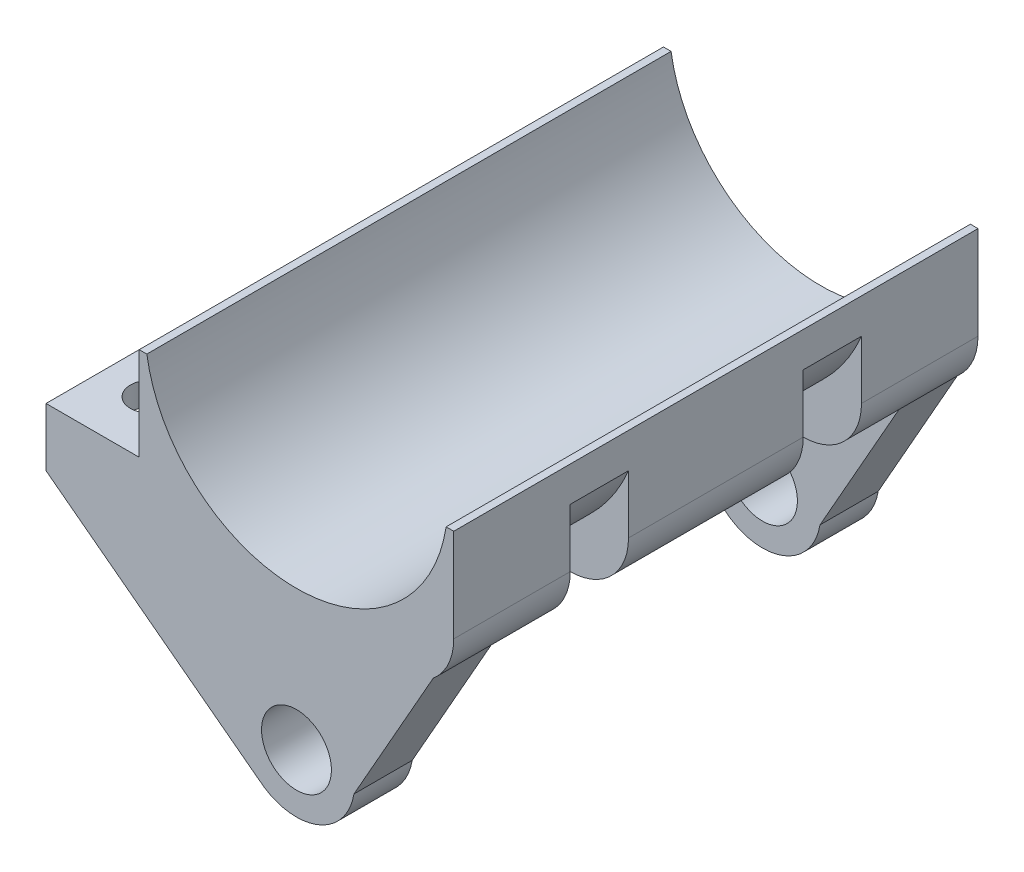
from build123d import *

# Parameters (mm, degrees)
BOSS_EXTRUDE1_DEPTH = 45
SKETCH2_W           = 10
SKETCH2_H           = 5
BOSS_EXTRUDE2_DEPTH = 15
SKETCH3_R           = 3
CUT_EXTRUDE1_DEPTH  = 50.317846668
FILLET1_R           = 5
CUT_EXTRUDE2_DEPTH  = 5
LPATTERN1_COUNT     = 2
LPATTERN1_PITCH     = 20
CHAMFER1_DEPTH      = 5
CHAMFER1_START      = 40
CHAMFER1_2_DEPTH    = 5
BOSS_EXTRUDE3_DEPTH = 2
BOSS_EXTRUDE9_REACH = 52.361
SKETCH8_W           = 8.2
SKETCH8_H           = 2
SKETCH9_R           = 1.75
CUT_EXTRUDE4_DEPTH  = 47


with BuildPart() as part:
    # Sketch1 → Boss-Extrude1 (new body)
    with BuildSketch(Plane.XY):
        with BuildLine():
            Line((12.845232579, 13), (13.5, 13))
            Line((13.5, 13), (13.5, 5))
            ThreePointArc((13.5, 5), (12.035533906, 1.464466094), (8.5, 0))
            Line((8.5, 0), (-8.5, 0))
            ThreePointArc((-8.5, 0), (-12.035533906, 1.464466094), (-13.5, 5))
            Line((-13.5, 5), (-13.5, 13))
            Line((-13.5, 13), (-12.845232579, 13))
            ThreePointArc((-12.845232579, 13), (0, 2), (12.845232579, 13))
        make_face()
    extrude(amount=BOSS_EXTRUDE1_DEPTH)

    # Sketch2 → Boss-Extrude2 (add)
    with BuildSketch(Plane.XZ):
        with Locations((0, 42.5)):
            Rectangle(SKETCH2_W, SKETCH2_H)
        with Locations((0, 2.5)):
            Rectangle(SKETCH2_W, SKETCH2_H)
    extrude(amount=BOSS_EXTRUDE2_DEPTH)

    # Sketch3 → Cut-Extrude1 (cut, through all)
    with BuildSketch(Plane.XY.offset(45)):
        with Locations((0, -10)):
            Circle(SKETCH3_R)
    extrude(amount=-CUT_EXTRUDE1_DEPTH, mode=Mode.SUBTRACT)

    # Fillet1
    fillet1_edges = [part.edges().sort_by_distance(p)[0] for p in [
        (-5, -15, 2.5),
        (-5, -15, 42.5),
        (5, -15, 42.5),
        (5, -15, 2.5),
    ]]
    fillet(fillet1_edges, radius=FILLET1_R - 0.0001)  # a hair under: the kernel refuses the full size

    # Sketch4 → Cut-Extrude2 (cut)
    with BuildSketch(Plane.XY.offset(10)):
        with BuildLine():
            Line((-13.5, 10), (-13.5, 5))
            ThreePointArc((-13.5, 5), (-12.035533906, 1.464466094), (-8.5, 0))
            Line((-8.5, 0), (5, 0))
            Line((5, 0), (8.5, 0))
            ThreePointArc((8.5, 0), (12.035533906, 1.464466094), (13.5, 5))
            Line((13.5, 5), (13.5, 10))
            ThreePointArc((13.5, 10), (8.11249037, 3.456264445), (0, 1))
            ThreePointArc((0, 1), (-8.11249037, 3.456264445), (-13.5, 10))
        make_face()
    cut_extrude2 = extrude(amount=CUT_EXTRUDE2_DEPTH, mode=Mode.SUBTRACT)

    # LPattern1: Cut-Extrude2 ×2
    with Locations(*[(0, 0, i * LPATTERN1_PITCH) for i in range(1, LPATTERN1_COUNT)]):
        add(cut_extrude2, mode=Mode.SUBTRACT)

    # Chamfer1: read off the stored shape, not the designer's step
    # Chamfer1 outline → Chamfer1 (add)
    with BuildSketch(Plane.XY):
        with BuildLine():
            ThreePointArc((5, -10), (4.983300978, -10.408303031), (4.933315454, -10.813878757))
            Line((4.933315454, -10.813878757), (11.733315454, 1.186121243))
            ThreePointArc((11.733315454, 1.186121243), (10.222005548, 0.305886996), (8.5, 0))
            Line((8.5, 0), (5, 0))
            Line((5, 0), (5, -10))
        make_face()
        with BuildLine():
            Line((-11.733315454, 1.186121243), (-4.933315454, -10.813878757))
            ThreePointArc((-4.933315454, -10.813878757), (-4.983300978, -10.408303031), (-5, -10))
            Line((-5, -10), (-5, 0))
            Line((-5, 0), (-8.5, 0))
            ThreePointArc((-8.5, 0), (-10.222005548, 0.305886996), (-11.733315454, 1.186121243))
        make_face()
    extrude(amount=CHAMFER1_DEPTH)

    # Chamfer1 2 outline → Chamfer1 2 (add)
    with BuildSketch(Plane.XY.offset(CHAMFER1_START)):
        with BuildLine():
            ThreePointArc((5, -10), (4.983300978, -10.408303031), (4.933315454, -10.813878757))
            Line((4.933315454, -10.813878757), (11.733315454, 1.186121243))
            ThreePointArc((11.733315454, 1.186121243), (10.222005548, 0.305886996), (8.5, 0))
            Line((8.5, 0), (5, 0))
            Line((5, 0), (5, -10))
        make_face()
        with BuildLine():
            Line((-11.733315454, 1.186121243), (-4.933315454, -10.813878757))
            ThreePointArc((-4.933315454, -10.813878757), (-4.983300978, -10.408303031), (-5, -10))
            Line((-5, -10), (-5, 0))
            Line((-5, 0), (-8.5, 0))
            ThreePointArc((-8.5, 0), (-10.222005548, 0.305886996), (-11.733315454, 1.186121243))
        make_face()
    extrude(amount=CHAMFER1_2_DEPTH)

    # Sketch6 → Boss-Extrude3 (add)
    with BuildSketch(Plane(origin=(0, 0, 0), x_dir=(-1, 0, 0), z_dir=(0, 0, -1))):
        Polygon((3.223775495, -13.830713979), (21.5, 0), (21.5, 5), (13.5, 5), align=None)
    boss_extrude3 = extrude(amount=-BOSS_EXTRUDE3_DEPTH)

    # Mirror1: Boss-Extrude3 across plane
    add(boss_extrude3.mirror(Plane.XY.offset(22.5)))

    # Sketch8 → Boss-Extrude9 (add, up to next)
    with BuildSketch(Plane.XY.offset(2), mode=Mode.PRIVATE) as boss_extrude9_sk1:
        with Locations((-17.4, 4)):
            Rectangle(SKETCH8_W, SKETCH8_H)
    boss_extrude9_tool1 = extrude(boss_extrude9_sk1.sketch, amount=BOSS_EXTRUDE9_REACH, mode=Mode.PRIVATE) - part.part
    add(boss_extrude9_tool1.solids().sort_by_distance((-17.4, 4, 2))[0])

    # Sketch9 → Cut-Extrude4 (cut)
    with BuildSketch(Plane(origin=(0, 5, 0), x_dir=(1, 0, 0), z_dir=(0, 1, 0))):
        with Locations(Location((-17.5, -5, 0), (0, 0, 180))):
            Circle(SKETCH9_R)
        with Locations(Location((-17.5, -40, 0), (0, 0, 180))):
            Circle(SKETCH9_R)
    extrude(amount=-CUT_EXTRUDE4_DEPTH, mode=Mode.SUBTRACT)


solid = part.part
